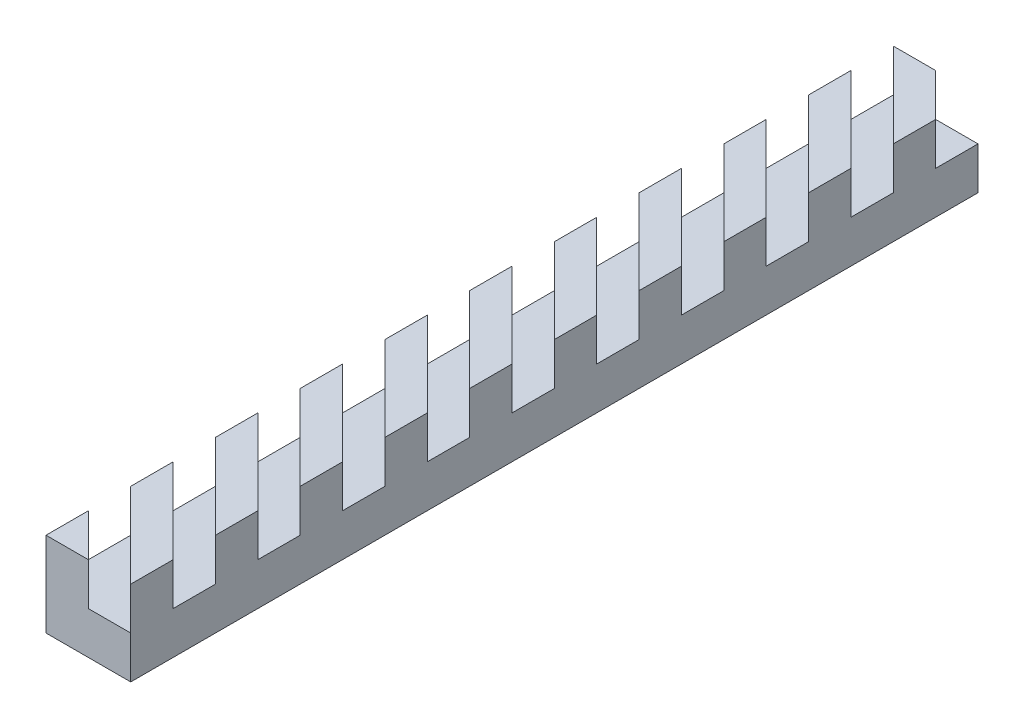
from build123d import *

# Parameters (mm, degrees)
SKETCH1_W            = 100
SKETCH1_H            = 100
BOSS_EXTRUDE1_DEPTH  = 1000
SKETCH6_W            = 50
SKETCH6_H            = 50
CUT_EXTRUDE1_DEPTH   = 1000
LPATTERN1_COUNT      = 10
LPATTERN1_PITCH      = 100
LPATTERN1_COUNT_DIR2 = 10
LPATTERN1_PITCH_DIR2 = 100


with BuildPart() as part:
    # Sketch1 → Boss-Extrude1 (new body)
    with BuildSketch(Plane.XY):
        with Locations((-3.9408867, 4.926108374)):
            Rectangle(SKETCH1_W, SKETCH1_H)
    extrude(amount=-BOSS_EXTRUDE1_DEPTH)

    # Sketch6 → Cut-Extrude1 (cut, along a direction that is not the sketch's normal)
    with BuildSketch(Plane(origin=(46.0591133, 0, 0), x_dir=(0, 0, -1), z_dir=(1, 0, 0))):
        with Locations((75, 29.926108374)):
            Rectangle(SKETCH6_W, SKETCH6_H)
    cut_extrude1 = extrude(amount=-CUT_EXTRUDE1_DEPTH, dir=(0.7071067811865516, 0, 0.7071067811865435), mode=Mode.SUBTRACT)

    # LPattern1: Cut-Extrude1 10 × 10
    with Locations(*[Vector(0, 0, -1) * (i * LPATTERN1_PITCH) + Vector(0, 0, 1) * (j * LPATTERN1_PITCH_DIR2) for i in range(LPATTERN1_COUNT) for j in range(LPATTERN1_COUNT_DIR2) if (i, j) != (0, 0)]):
        add(cut_extrude1, mode=Mode.SUBTRACT)


solid = part.part
